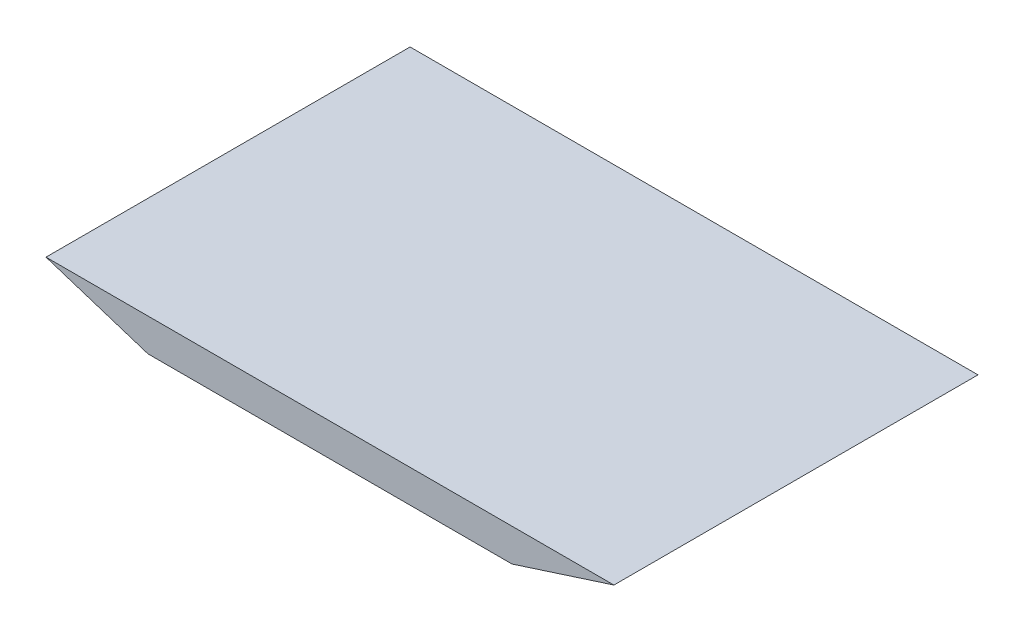
from build123d import *

# Parameters (mm, degrees)
BOSS_EXTRUDE1_DEPTH = 100


with BuildPart() as part:
    # Sketch1 → Boss-Extrude1 (new body)
    with BuildSketch(Plane.XY):
        Polygon((0, 0), (156, 0), (128, -9), (28, -9), align=None)
    extrude(amount=BOSS_EXTRUDE1_DEPTH)


solid = part.part
